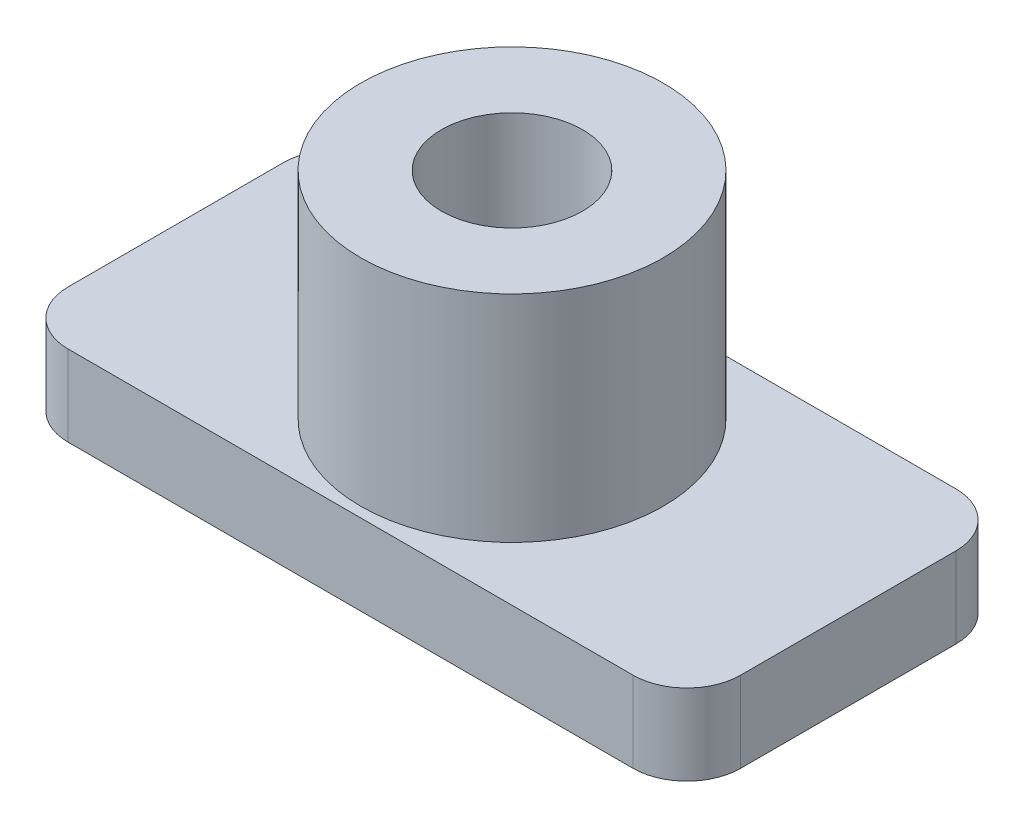
from build123d import *

# Parameters (mm, degrees)
SKETCH1_W           = 25
SKETCH1_H           = 12
BOSS_EXTRUDE1_DEPTH = 3
SKETCH2_R           = 5.625
SKETCH2_R_2         = 2.625
BOSS_EXTRUDE2_DEPTH = 8
FILLET1_R           = 2


with BuildPart() as part:
    # Sketch1 → Boss-Extrude1 (new body)
    with BuildSketch(Plane(origin=(0, 0, 0), x_dir=(1, 0, 0), z_dir=(0, 1, 0))):
        Rectangle(SKETCH1_W, SKETCH1_H)
    extrude(amount=BOSS_EXTRUDE1_DEPTH)

    # Sketch2 → Boss-Extrude2 (add)
    with BuildSketch(Plane(origin=(0, 3, 0), x_dir=(1, 0, 0), z_dir=(0, 1, 0))):
        Circle(SKETCH2_R)
        Circle(SKETCH2_R_2, mode=Mode.SUBTRACT)
    extrude(amount=BOSS_EXTRUDE2_DEPTH)

    # Fillet1
    fillet1_edges = [part.edges().sort_by_distance(p)[0] for p in [
        (12.5, 1.5, -6),
        (12.5, 1.5, 6),
        (-12.5, 1.5, -6),
        (-12.5, 1.5, 6),
    ]]
    fillet(fillet1_edges, radius=FILLET1_R)


solid = part.part
